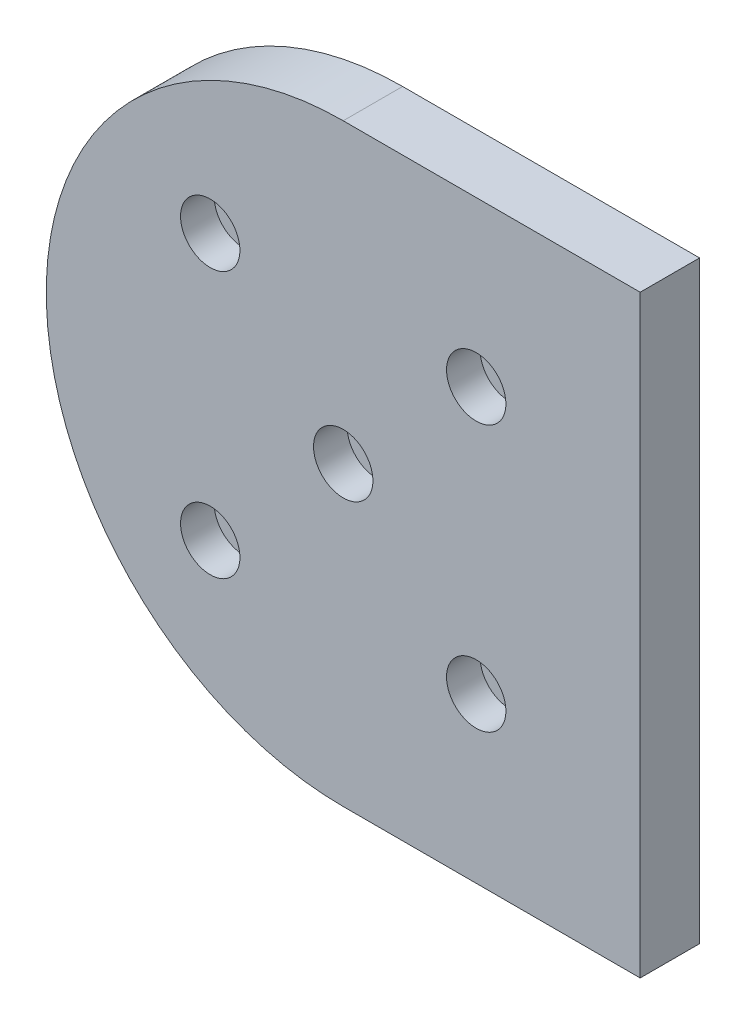
from build123d import *

# Parameters (mm, degrees)
EXTRUDE_1_DEPTH              = 6
SKETCH_2_R                   = 28.5
CUT_EXTRUDE_1_DEPTH          = 1
HOLE_START                   = 2.6
HOLE_WIZARD_M3_1_OUTLINE_R   = 3
HOLE_WIZARD_M3_1_DEPTH       = 3.4
HOLE_START_2                 = 1
HOLE_WIZARD_M3_1_2_OUTLINE_R = 1.7
HOLE_WIZARD_M3_1_2_DEPTH     = 1.6


# Read off the part's stored shape, not the designer's step: M3 六角圆柱头螺钉的柱形沉头孔1
with BuildPart() as part:
    # 草图1 → 凸台-拉伸1 (new body)
    with BuildSketch(Plane.XY):
        with BuildLine():
            Line((0, 30), (30, 30))
            Line((30, 30), (30, -30))
            Line((30, -30), (0, -30))
            ThreePointArc((0, -30), (-30, 0), (0, 30))
        make_face()
    extrude(amount=EXTRUDE_1_DEPTH)

    # 草图2 → 切除-拉伸1 (cut)
    with BuildSketch(Plane(origin=(0, 0, 0), x_dir=(-1, 0, 0), z_dir=(0, 0, -1))):
        Circle(SKETCH_2_R)
    extrude(amount=-CUT_EXTRUDE_1_DEPTH, mode=Mode.SUBTRACT)

    # M3 六角圆柱头螺钉的柱形沉头孔1 outline → M3 六角圆柱头螺钉的柱形沉头孔1 (cut)
    with BuildSketch(Plane.XY.offset(HOLE_START)):
        with Locations((13.435028843, 13.435028843)):
            Circle(HOLE_WIZARD_M3_1_OUTLINE_R)
        with Locations((-13.435028843, -13.435028843)):
            Circle(HOLE_WIZARD_M3_1_OUTLINE_R)
        with Locations((-13.435028843, 13.435028843)):
            Circle(HOLE_WIZARD_M3_1_OUTLINE_R)
        with Locations((13.435028843, -13.435028843)):
            Circle(HOLE_WIZARD_M3_1_OUTLINE_R)
        Circle(HOLE_WIZARD_M3_1_OUTLINE_R)
    extrude(amount=HOLE_WIZARD_M3_1_DEPTH, mode=Mode.SUBTRACT)

    # Hole Wizard M3 _1 2 outline → Hole Wizard M3 _1 2 (cut)
    with BuildSketch(Plane.XY.offset(HOLE_START_2)):
        with Locations((13.435028843, 13.435028843)):
            Circle(HOLE_WIZARD_M3_1_2_OUTLINE_R)
        with Locations((-13.435028843, -13.435028843)):
            Circle(HOLE_WIZARD_M3_1_2_OUTLINE_R)
        with Locations((-13.435028843, 13.435028843)):
            Circle(HOLE_WIZARD_M3_1_2_OUTLINE_R)
        with Locations((13.435028843, -13.435028843)):
            Circle(HOLE_WIZARD_M3_1_2_OUTLINE_R)
        Circle(HOLE_WIZARD_M3_1_2_OUTLINE_R)
    extrude(amount=HOLE_WIZARD_M3_1_2_DEPTH, mode=Mode.SUBTRACT)


solid = part.part
